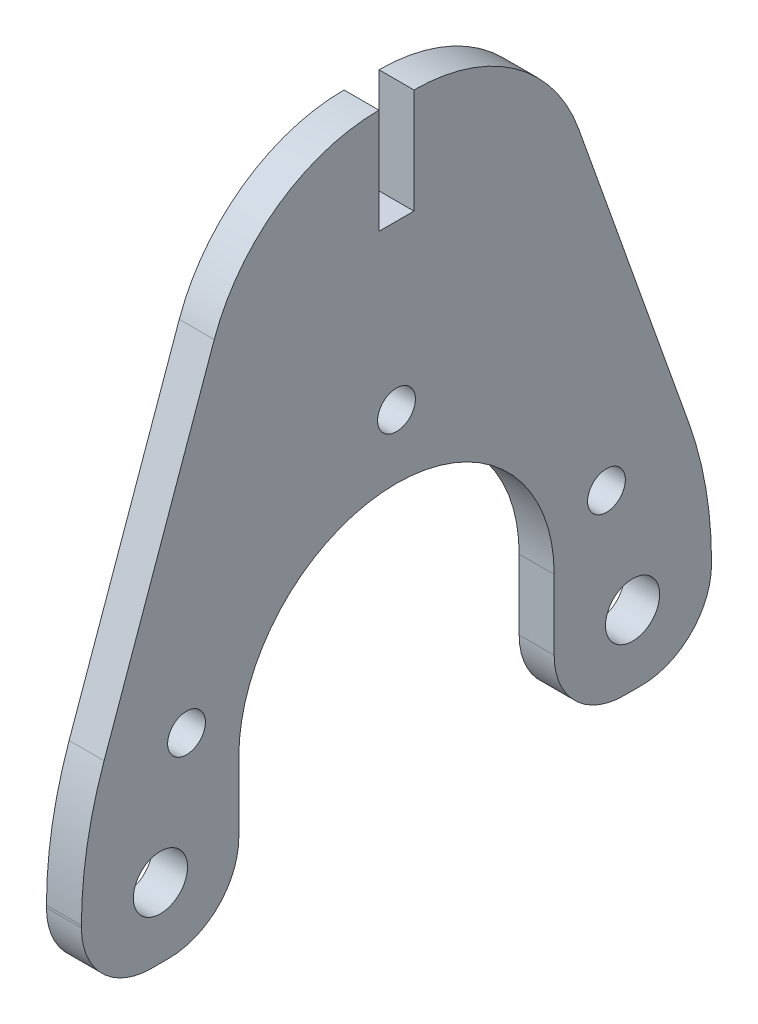
from build123d import *

# Parameters (mm, degrees)
BOSS_EXTRUDE1_DEPTH              = 3.175
F_10_0_1935_DIAMETER_HOLE1_D     = 4.9149
F_10_0_1935_DIAMETER_HOLE1_DEPTH = 19.001994
F_10_0_1935_DIAMETER_HOLE1_TIP   = 1.476584928
SKETCH4_R                        = 1.7145
CUT_EXTRUDE1_DEPTH               = 53.951543936
FILLET2_R                        = 35.56
FILLET1_R                        = 6.35


with BuildPart() as part:
    # Sketch1 → Boss-Extrude1 (new body)
    with BuildSketch(Plane(origin=(0, 0, 0), x_dir=(0, 0, -1), z_dir=(1, 0, 0))):
        with BuildLine():
            Line((1.5875, 44.45), (1.5875, 34.925))
            Line((1.5875, 34.925), (-1.5875, 34.925))
            Line((-1.5875, 34.925), (-1.5875, 44.45))
            ThreePointArc((-1.5875, 44.45), (-10.740674928, 41.545544081), (-16.544559386, 33.894962362))
            Line((-16.544559386, 33.894962362), (-28.6004, 0))
            Line((-28.6004, 0), (-28.6004, -12.7))
            Line((-28.6004, -12.7), (-14.3129, -12.7))
            Line((-14.3129, -12.7), (-14.3129, 0))
            ThreePointArc((-14.3129, 0), (0, 14.3129), (14.3129, 0))
            Line((14.3129, 0), (14.3129, -12.7))
            Line((14.3129, -12.7), (28.6004, -12.7))
            Line((28.6004, -12.7), (28.6004, 0))
            Line((28.6004, 0), (16.544559386, 33.894962362))
            ThreePointArc((16.544559386, 33.894962362), (10.740674928, 41.545544081), (1.5875, 44.45))
        make_face()
    extrude(amount=BOSS_EXTRUDE1_DEPTH)

    # #10 (0.1935) Diameter Hole1
    with Locations(Plane.ZY):
        with Locations((-21.43125, -6.35), (21.43125, -6.35)):
            Hole(F_10_0_1935_DIAMETER_HOLE1_D / 2, depth=F_10_0_1935_DIAMETER_HOLE1_DEPTH)
            with Locations((0, 0, -(F_10_0_1935_DIAMETER_HOLE1_DEPTH + F_10_0_1935_DIAMETER_HOLE1_TIP / 2))):  # 118° drill point
                Cone(0, F_10_0_1935_DIAMETER_HOLE1_D / 2, F_10_0_1935_DIAMETER_HOLE1_TIP, mode=Mode.SUBTRACT)

    # Sketch4 → Cut-Extrude1 (cut, through all)
    with BuildSketch(Plane(origin=(3.175, 0, 0), x_dir=(0, 0, -1), z_dir=(1, 0, 0))):
        with Locations((0, 20.09775)):
            Circle(SKETCH4_R)
        with Locations((-19.061573026, 4.22275)):
            Circle(SKETCH4_R)
        with Locations((19.061573026, 4.22275)):
            Circle(SKETCH4_R)
    extrude(amount=-CUT_EXTRUDE1_DEPTH, mode=Mode.SUBTRACT)

    # Fillet2
    fillet2_edges = [part.edges().sort_by_distance(p)[0] for p in [
        (1.5875, 0, 28.6004),
        (1.5875, 0, -28.6004),
    ]]
    fillet(fillet2_edges, radius=FILLET2_R)

    # Fillet1
    fillet1_edges = [part.edges().sort_by_distance(p)[0] for p in [
        (1.5875, -12.7, -28.6004),
        (1.5875, -12.7, -14.3129),
        (1.5875, -12.7, 28.6004),
        (1.5875, -12.7, 14.3129),
    ]]
    fillet(fillet1_edges, radius=FILLET1_R)


solid = part.part
